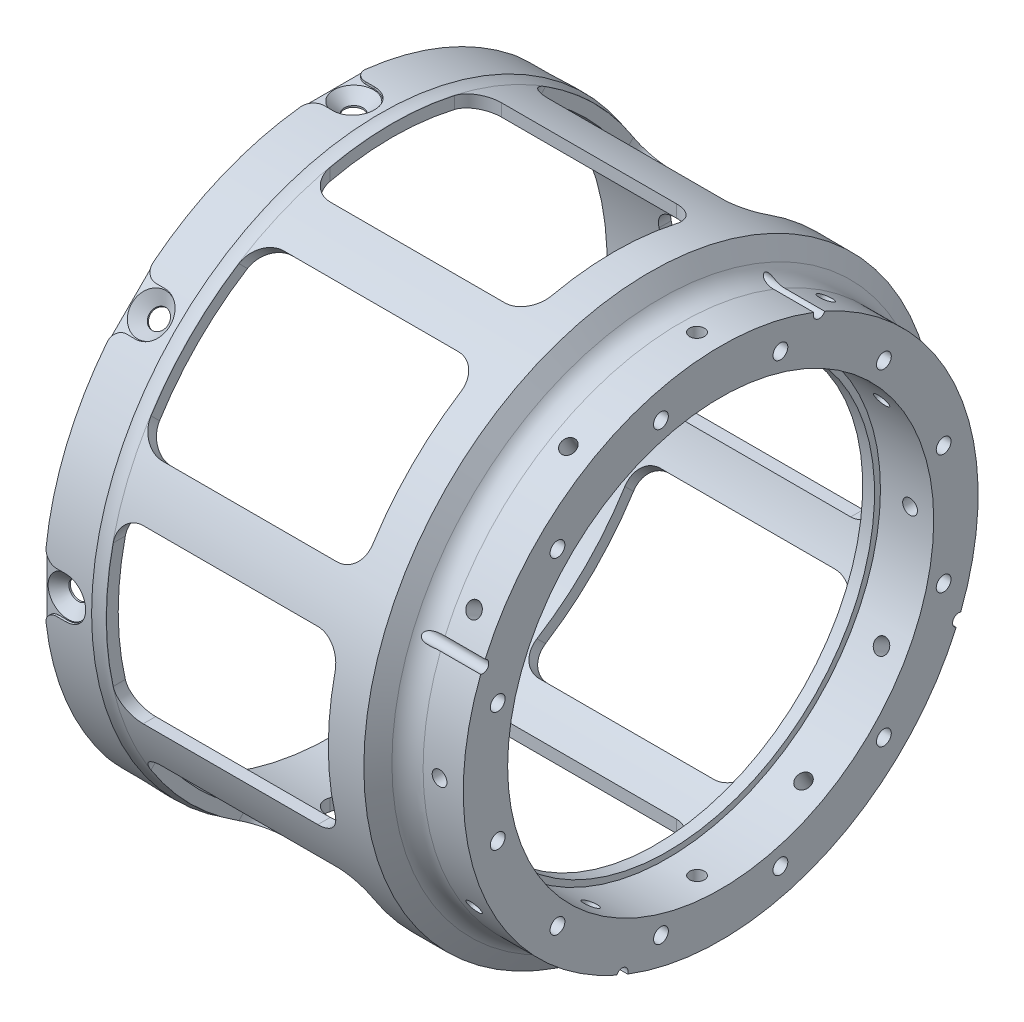
from build123d import *

# Parameters (mm, degrees)
SKETCH2_W                                       = 37.5
SKETCH2_H                                       = 29
CUT_EXTRUDE1_DEPTH                              = 96.147937445
FILLET1_R                                       = 4
CIRPATTERN1_COUNT                               = 8
FILLET1_OF_CIRPATTERN1_R                        = 4
SKETCH3_R                                       = 1.5
CUT_EXTRUDE2_DEPTH                              = 96.147937445
CIRPATTERN2_COUNT                               = 8
CUT_EXTRUDE3_DEPTH                              = 0.5
FILLET3_R                                       = 2
CIRPATTERN3_COUNT                               = 8
FILLET3_OF_CIRPATTERN3_R                        = 2
CSK_FOR_M3_FLAT_HEAD_MACHINE_SCREW2_D           = 3.2
CSK_FOR_M3_FLAT_HEAD_MACHINE_SCREW2_CSINK_D     = 6.7
CSK_FOR_M3_FLAT_HEAD_MACHINE_SCREW2_CSINK_ANGLE = 90
CIRPATTERN4_COUNT                               = 8
SKETCH12_R                                      = 1.25
CUT_EXTRUDE4_DEPTH                              = 96.147937547
CIRPATTERN5_COUNT                               = 12
SKETCH13_R                                      = 1.25
CUT_EXTRUDE5_DEPTH                              = 96.147937616
CIRPATTERN6_COUNT                               = 12
CUT_EXTRUDE6_DEPTH                              = 88.321990531
FILLET4_R                                       = 4
FILLET5_R                                       = 4
CIRPATTERN7_START                               = 49
CIRPATTERN7_DEPTH                               = 4.5
FILLET6_R                                       = 4
FILLET7_R                                       = 4
SKETCH15_R                                      = 1
CUT_EXTRUDE7_DEPTH                              = 88.321990531
CIRPATTERN8_COUNT                               = 4


with BuildPart() as part:
    # Sketch1 → Revolve1 (revolve)
    with BuildSketch(Plane.XY, mode=Mode.PRIVATE) as revolve1_sk:
        Polygon((0, 46.3), (50, 46.3), (50, 44), (53.5, 44), (53.5, 42), (54.5, 35), (56.5, 35), (56.5, 36), (65.5, 36), (65.5, 43.5), (56.5, 43.5), (53.5, 48.3), (8, 48.3), (8, 48.8), (0, 48.8), align=None)
    revolve(revolve1_sk.sketch.rotate(Axis((0, 0, 0), (1, 0, 0)), 90), axis=Axis((0, 0, 0), (1, 0, 0)))

    # Sketch2 → Cut-Extrude1 (cut, through all)
    with BuildSketch(Plane.XY):
        with Locations((28.75, 0)):
            Rectangle(SKETCH2_W, SKETCH2_H)
    cut_extrude1 = extrude(amount=-CUT_EXTRUDE1_DEPTH, mode=Mode.SUBTRACT)

    # Fillet1
    fillet1_edges = [part.edges().sort_by_distance(p)[0] for p in [
        (47.5, 14.5, -45.021508425),
        (47.5, -14.5, -45.021508425),
        (10, -14.5, -45.021508425),
        (10, 14.5, -45.021508425),
    ]]
    fillet(fillet1_edges, radius=FILLET1_R)

    # CirPattern1: Cut-Extrude1 ×8 about axis
    cirpattern1_axis = Axis((0, 0, 0), (1, 0, 0))
    for i in range(1, CIRPATTERN1_COUNT):
        add(cut_extrude1.rotate(cirpattern1_axis, i * 360 / CIRPATTERN1_COUNT), mode=Mode.SUBTRACT)

    # Fillet1 of CirPattern1
    fillet1_of_cirpattern1_edges = [part.edges().sort_by_distance(p)[0] for p in [
        (47.5, 42.088062233, -21.581965579),
        (47.5, 21.581965579, -42.088062233),
        (10, 21.581965579, -42.088062233),
        (10, 42.088062233, -21.581965579),
        (47.5, 45.021508425, 14.5),
        (47.5, 45.021508425, -14.5),
        (10, 45.021508425, -14.5),
        (10, 45.021508425, 14.5),
        (47.5, 21.581965579, 42.088062233),
        (47.5, 42.088062233, 21.581965579),
        (10, 42.088062233, 21.581965579),
        (10, 21.581965579, 42.088062233),
        (47.5, -14.5, 45.021508425),
        (47.5, 14.5, 45.021508425),
        (10, 14.5, 45.021508425),
        (10, -14.5, 45.021508425),
        (47.5, -42.088062233, 21.581965579),
        (47.5, -21.581965579, 42.088062233),
        (10, -21.581965579, 42.088062233),
        (10, -42.088062233, 21.581965579),
        (47.5, -45.021508425, -14.5),
        (47.5, -45.021508425, 14.5),
        (10, -45.021508425, 14.5),
        (10, -45.021508425, -14.5),
        (47.5, -21.581965579, -42.088062233),
        (47.5, -42.088062233, -21.581965579),
        (10, -42.088062233, -21.581965579),
        (10, -21.581965579, -42.088062233),
    ]]
    fillet(fillet1_of_cirpattern1_edges, radius=FILLET1_OF_CIRPATTERN1_R)

    # Sketch3 → Cut-Extrude2 (cut, through all)
    with BuildSketch(Plane.XY):
        with Locations((3.5, 0)):
            Circle(SKETCH3_R)
    cut_extrude2 = extrude(amount=-CUT_EXTRUDE2_DEPTH, mode=Mode.SUBTRACT)

    # CirPattern2: Cut-Extrude2 ×8 about axis
    cirpattern2_axis = Axis((0, 0, 0), (-1, 0, 0))
    for i in range(1, CIRPATTERN2_COUNT):
        add(cut_extrude2.rotate(cirpattern2_axis, i * 360 / CIRPATTERN2_COUNT), mode=Mode.SUBTRACT)

    # Sketch7 → Cut-Extrude3 (cut)
    with BuildSketch(Plane.XY.offset(48.8)):
        with BuildLine():
            Line((3.5, 3.5), (-4.5, 3.5))
            Line((-4.5, 3.5), (-4.5, -3.5))
            Line((-4.5, -3.5), (3.5, -3.5))
            ThreePointArc((3.5, -3.5), (7, 0), (3.5, 3.5))
        make_face()
    cut_extrude3 = extrude(amount=-CUT_EXTRUDE3_DEPTH, mode=Mode.SUBTRACT)

    # Fillet3
    fillet3_edges = [part.edges().sort_by_distance(p)[0] for p in [
        (0, -3.5, 48.487162941),
        (0, 3.5, 48.487162941),
    ]]
    fillet(fillet3_edges, radius=FILLET3_R)

    # CirPattern3: Cut-Extrude3 ×8 about axis
    cirpattern3_axis = Axis((0, 0, 0), (1, 0, 0))
    for i in range(1, CIRPATTERN3_COUNT):
        add(cut_extrude3.rotate(cirpattern3_axis, i * 360 / CIRPATTERN3_COUNT), mode=Mode.SUBTRACT)

    # Fillet3 of CirPattern3
    fillet3_of_cirpattern3_edges = [part.edges().sort_by_distance(p)[0] for p in [
        (0, -36.76047545, 31.810727982),
        (0, -31.810727982, 36.76047545),
        (0, -48.487162941, -3.5),
        (0, -48.487162941, 3.5),
        (0, -31.810727982, -36.76047545),
        (0, -36.76047545, -31.810727982),
        (0, 3.5, -48.487162941),
        (0, -3.5, -48.487162941),
        (0, 36.76047545, -31.810727982),
        (0, 31.810727982, -36.76047545),
        (0, 48.487162941, 3.5),
        (0, 48.487162941, -3.5),
        (0, 31.810727982, 36.76047545),
        (0, 36.76047545, 31.810727982),
    ]]
    fillet(fillet3_of_cirpattern3_edges, radius=FILLET3_OF_CIRPATTERN3_R)

    # CSK for M3 Flat Head Machine Screw2 (through all)
    with Locations(Plane.XY.offset(48.3)):
        with Locations((3.5, 0)):
            csk_for_m3_flat_head_machine_screw2 = CounterSinkHole(CSK_FOR_M3_FLAT_HEAD_MACHINE_SCREW2_D / 2, CSK_FOR_M3_FLAT_HEAD_MACHINE_SCREW2_CSINK_D / 2, counter_sink_angle=CSK_FOR_M3_FLAT_HEAD_MACHINE_SCREW2_CSINK_ANGLE)

    # CirPattern4: CSK for M3 Flat Head Machine Screw2 ×8 about axis
    cirpattern4_axis = Axis((0, 0, 0), (-1, 0, 0))
    for i in range(1, CIRPATTERN4_COUNT):
        add(csk_for_m3_flat_head_machine_screw2.rotate(cirpattern4_axis, i * 360 / CIRPATTERN4_COUNT), mode=Mode.SUBTRACT)

    # Sketch12 → Cut-Extrude4 (cut, through all)
    with BuildSketch(Plane.XY):
        with Locations((61.5, 0)):
            Circle(SKETCH12_R)
    cut_extrude4 = extrude(amount=-CUT_EXTRUDE4_DEPTH, mode=Mode.SUBTRACT)

    # CirPattern5: Cut-Extrude4 ×12 about axis
    cirpattern5_axis = Axis((65.5, 0, 0), (-1, 0, 0))
    for i in range(1, CIRPATTERN5_COUNT):
        add(cut_extrude4.rotate(cirpattern5_axis, i * 360 / CIRPATTERN5_COUNT), mode=Mode.SUBTRACT)

    # Sketch13 → Cut-Extrude5 (cut, through all)
    with BuildSketch(Plane(origin=(65.5, 0, 0), x_dir=(0, 0, -1), z_dir=(1, 0, 0))):
        with Locations((-10.093942759, 37.671107225)):
            Circle(SKETCH13_R)
    cut_extrude5 = extrude(amount=-CUT_EXTRUDE5_DEPTH, mode=Mode.SUBTRACT)

    # CirPattern6: Cut-Extrude5 ×12 about axis
    cirpattern6_axis = Axis((0, 0, 0), (1, 0, 0))
    for i in range(1, CIRPATTERN6_COUNT):
        add(cut_extrude5.rotate(cirpattern6_axis, i * 360 / CIRPATTERN6_COUNT), mode=Mode.SUBTRACT)

    # Sketch14 → Cut-Extrude6 (cut, through all)
    with BuildSketch(Plane.ZY.offset(-53.5)):
        with BuildLine():
            Line((-19.502152685, 40.887113381), (-18.94248826, 39.713752511))
            ThreePointArc((-18.94248826, 39.713752511), (-16.838071024, 40.65069943), (-14.687501806, 41.476225608))
            Line((-14.687501806, 41.476225608), (-15.121450723, 42.701659546))
            ThreePointArc((-15.121450723, 42.701659546), (-17.335559486, 41.851742823), (-19.502152685, 40.887113381))
        make_face()
    extrude(amount=CUT_EXTRUDE6_DEPTH, mode=Mode.SUBTRACT)

    # Fillet4
    # the kernel refuses this fillet: 4 mm, written as the material it takes off along each edge
    with BuildSketch(Plane(origin=(53.5, 39.713752511, -18.94248826), x_dir=(0, -0.4588580720128556, -0.8885095777472772), z_dir=(-1, 0, 0))) as fillet4_piece_1:
        with BuildLine():
            CenterArc((2.911368572, -3.997996647), FILLET4_R, 91.813445494, 45.758651553)
            Line((-0.041138904, -1.29934891), (0, 0))
            ThreePointArc((0, 0), (1.392393665, -0.022036883), (2.78478733, 0))
        make_face()
    extrude(amount=10.461968324, mode=Mode.SUBTRACT)
    with BuildSketch(Plane(origin=(53.5, 41.476225608, -14.687501806), x_dir=(0, 0.9426414910921771, -0.33380685923377484), z_dir=(-1, 0, 0))) as fillet4_piece_2:
        with BuildLine():
            CenterArc((3.903863135, -3.036428293), FILLET4_R, 130.614457458, 45.758651553)
            ThreePointArc((-0.08812546, -2.783392602), (-0.022036883, -1.392393665), (0, 0))
            Line((0, 0), (1.3, 0))
        make_face()
    extrude(amount=10.461968324, mode=Mode.SUBTRACT)

    # Fillet5
    fillet5_edges = [part.edges().sort_by_distance(p)[0] for p in [
        (51.75, 42.701659546, -15.121450723),
        (51.75, 40.887113381, -19.502152685),
    ]]
    fillet(fillet5_edges, radius=FILLET5_R)

    # CirPattern7: read off the stored shape, not the designer's step
    # CirPattern7 outline → CirPattern7 (cut)
    with BuildSketch(Plane.YZ.offset(CIRPATTERN7_START)):
        with BuildLine():
            ThreePointArc((19.915786732, 39.902461564), (19.119342139, 40.869694368), (18.062736974, 41.543080447))
            ThreePointArc((18.062736974, 41.543080447), (17.335559486, 41.851742823), (16.603110094, 42.147677696))
            ThreePointArc((16.603110094, 42.147677696), (15.379821554, 42.418654511), (14.132713306, 42.297889009))
            ThreePointArc((14.132713306, 42.297889009), (13.081901048, 42.170019551), (12.034343571, 42.322270435))
            ThreePointArc((12.034343571, 42.322270435), (16.838071024, 40.650699429), (21.416798474, 38.435930365))
            ThreePointArc((21.416798474, 38.435930365), (20.568405845, 39.06900773), (19.915786732, 39.902461564))
        make_face()
        with BuildLine():
            ThreePointArc((-12.034343571, -42.322270436), (-16.838071024, -40.650699431), (-21.416798474, -38.435930367))
            ThreePointArc((-21.416798474, -38.435930367), (-20.568405845, -39.06900773), (-19.915786732, -39.902461564))
            ThreePointArc((-19.915786732, -39.902461564), (-19.119342139, -40.869694368), (-18.062736974, -41.543080447))
            ThreePointArc((-18.062736974, -41.543080447), (-17.335559486, -41.851742823), (-16.603110094, -42.147677696))
            ThreePointArc((-16.603110094, -42.147677696), (-15.379821554, -42.418654511), (-14.132713306, -42.297889009))
            ThreePointArc((-14.132713306, -42.297889009), (-13.081901048, -42.170019551), (-12.034343571, -42.322270436))
        make_face()
        with BuildLine():
            ThreePointArc((-42.322270435, 12.034343571), (-40.65069943, 16.838071024), (-38.435930366, 21.416798474))
            ThreePointArc((-38.435930366, 21.416798474), (-39.06900773, 20.568405845), (-39.902461564, 19.915786732))
            ThreePointArc((-39.902461564, 19.915786732), (-40.869694368, 19.119342139), (-41.543080447, 18.062736974))
            ThreePointArc((-41.543080447, 18.062736974), (-41.851742823, 17.335559486), (-42.147677696, 16.603110094))
            ThreePointArc((-42.147677696, 16.603110094), (-42.418654511, 15.379821554), (-42.297889009, 14.132713306))
            ThreePointArc((-42.297889009, 14.132713306), (-42.170019551, 13.081901048), (-42.322270435, 12.034343571))
        make_face()
    extrude(amount=CIRPATTERN7_DEPTH, mode=Mode.SUBTRACT)

    # Fillet6
    # the kernel refuses this fillet: 4 mm, written as the material it adds along each edge
    with BuildSketch(Plane(origin=(8, 0, 0), x_dir=(0, 0, 1), z_dir=(0, 1, 0))) as fillet6_piece_1:
        with BuildLine():
            CenterArc((52.3, 1.936491673), FILLET6_R, 180, 28.955024372)
            Line((48.8, 0), (48.3, 0))
            Line((48.3, 0), (48.3, 1.936491673))
        make_face()
    revolve(axis=Axis((8, 0, 0), (1, 0, 0)))

    # Fillet7
    fillet7_edges = [part.edges().sort_by_distance(p)[0] for p in [
        (56.5, 0, -43.5),
    ]]
    fillet(fillet7_edges, radius=FILLET7_R)

    # Sketch15 → Cut-Extrude7 (cut, through all)
    with BuildSketch(Plane.ZY.offset(-53.5)):
        with Locations((-16.646729308, 40.188759664)):
            Circle(SKETCH15_R)
    cut_extrude7 = extrude(amount=-CUT_EXTRUDE7_DEPTH, mode=Mode.SUBTRACT)

    # CirPattern8: Cut-Extrude7 ×4 about axis
    cirpattern8_axis = Axis((0, 0, 0), (1, 0, 0))
    for i in range(1, CIRPATTERN8_COUNT):
        add(cut_extrude7.rotate(cirpattern8_axis, i * 360 / CIRPATTERN8_COUNT), mode=Mode.SUBTRACT)


solid = part.part
